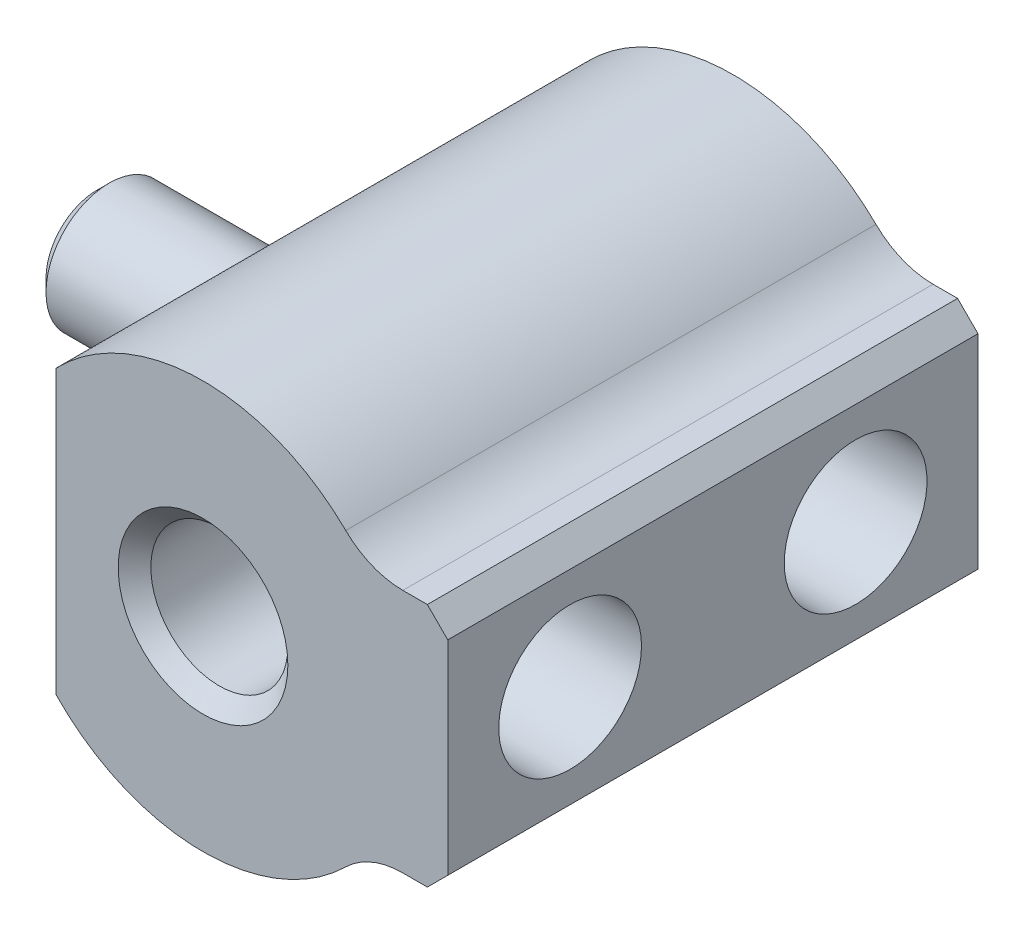
from build123d import *

# Parameters (mm, degrees)
SKETCH1_R           = 6.35
SKETCH1_R_2         = 2.1336
BOSS_EXTRUDE1_DEPTH = 8.255
CUT_EXTRUDE1_DEPTH  = 19.794283705
SKETCH4_R           = 1.9685
BOSS_EXTRUDE2_DEPTH = 6.985
SKETCH6_W           = 16.51
SKETCH6_H           = 7.62
BOSS_EXTRUDE3_DEPTH = 2.54
FILLET1_R           = 1.27
CHAMFER1_SIZE       = 0.381
SKETCH5_R           = 2.2225
CUT_EXTRUDE2_DEPTH  = 6.35
CHAMFER2_SIZE       = 0.508
FILLET2_R           = 2.54
CHAMFER3_SIZE       = 0.635


with BuildPart() as part:
    # Sketch1 → Boss-Extrude1 (new, symmetric)
    with BuildSketch(Plane.XY):
        Circle(SKETCH1_R)
        Circle(SKETCH1_R_2, mode=Mode.SUBTRACT)
    extrude(amount=BOSS_EXTRUDE1_DEPTH, both=True)

    # Sketch3 → Cut-Extrude1 (cut, through all)
    with BuildSketch(Plane.XY.offset(8.255)):
        with BuildLine():
            Line((-4.572, 4.4067353), (-4.572, -4.4067353))
            ThreePointArc((-4.572, -4.4067353), (-6.35, 0), (-4.572, 4.4067353))
        make_face()
        with BuildLine():
            Line((5.08, 3.81), (5.08, -3.81))
            ThreePointArc((5.08, -3.81), (6.35, 0), (5.08, 3.81))
        make_face()
    extrude(amount=-CUT_EXTRUDE1_DEPTH, mode=Mode.SUBTRACT)

    # Sketch4 → Boss-Extrude2 (add)
    with BuildSketch(Plane.ZY.offset(4.572)):
        Circle(SKETCH4_R)
    extrude(amount=BOSS_EXTRUDE2_DEPTH)

    # Sketch6 → Boss-Extrude3 (add)
    with BuildSketch(Plane(origin=(5.08, 0, 0), x_dir=(0, 0, -1), z_dir=(1, 0, 0))):
        Rectangle(SKETCH6_W, SKETCH6_H)
    extrude(amount=BOSS_EXTRUDE3_DEPTH)

    # Fillet1
    fillet1_edges = [part.edges().sort_by_distance(p)[0] for p in [
        (-4.572, 0, -1.9685),
    ]]
    fillet(fillet1_edges, radius=FILLET1_R)

    # Chamfer1
    chamfer1_edges = [part.edges().sort_by_distance(p)[0] for p in [
        (-11.557, 0, -1.9685),
    ]]
    chamfer(chamfer1_edges, length=CHAMFER1_SIZE)

    # Sketch5 → Cut-Extrude2 (cut)
    with BuildSketch(Plane(origin=(7.62, 0, 0), x_dir=(0, 0, -1), z_dir=(1, 0, 0))):
        with Locations((-4.445, 0)):
            Circle(SKETCH5_R)
        with Locations((4.445, 0)):
            Circle(SKETCH5_R)
    extrude(amount=-CUT_EXTRUDE2_DEPTH, mode=Mode.SUBTRACT)

    # Chamfer2
    chamfer2_edges = [part.edges().sort_by_distance(p)[0] for p in [
        (-2.1336, 0, -8.255),
        (-2.1336, 0, 8.255),
    ]]
    chamfer(chamfer2_edges, length=CHAMFER2_SIZE)

    # Fillet2
    fillet2_edges = [part.edges().sort_by_distance(p)[0] for p in [
        (5.08, -3.81, 0),
        (5.08, 3.81, 0),
    ]]
    fillet(fillet2_edges, radius=FILLET2_R)

    # Chamfer3
    chamfer3_edges = [part.edges().sort_by_distance(p)[0] for p in [
        (7.62, 3.81, 0),
        (7.62, -3.81, 0),
    ]]
    chamfer(chamfer3_edges, length=CHAMFER3_SIZE)


solid = part.part
